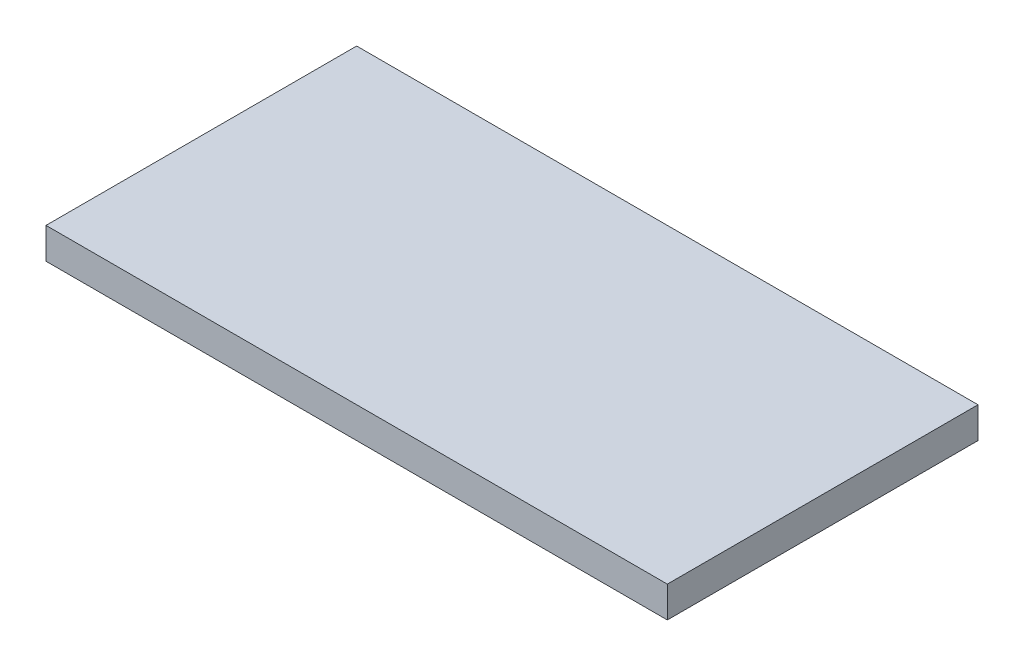
from build123d import *

# Parameters (mm, degrees)
SKETCH2_W           = 200
SKETCH2_H           = 100
BOSS_EXTRUDE1_DEPTH = 10


with BuildPart() as part:
    # Sketch2 → Boss-Extrude1 (new body)
    with BuildSketch(Plane(origin=(0, 0, 0), x_dir=(1, 0, 0), z_dir=(0, 1, 0))):
        Rectangle(SKETCH2_W, SKETCH2_H)
    extrude(amount=BOSS_EXTRUDE1_DEPTH)


solid = part.part
